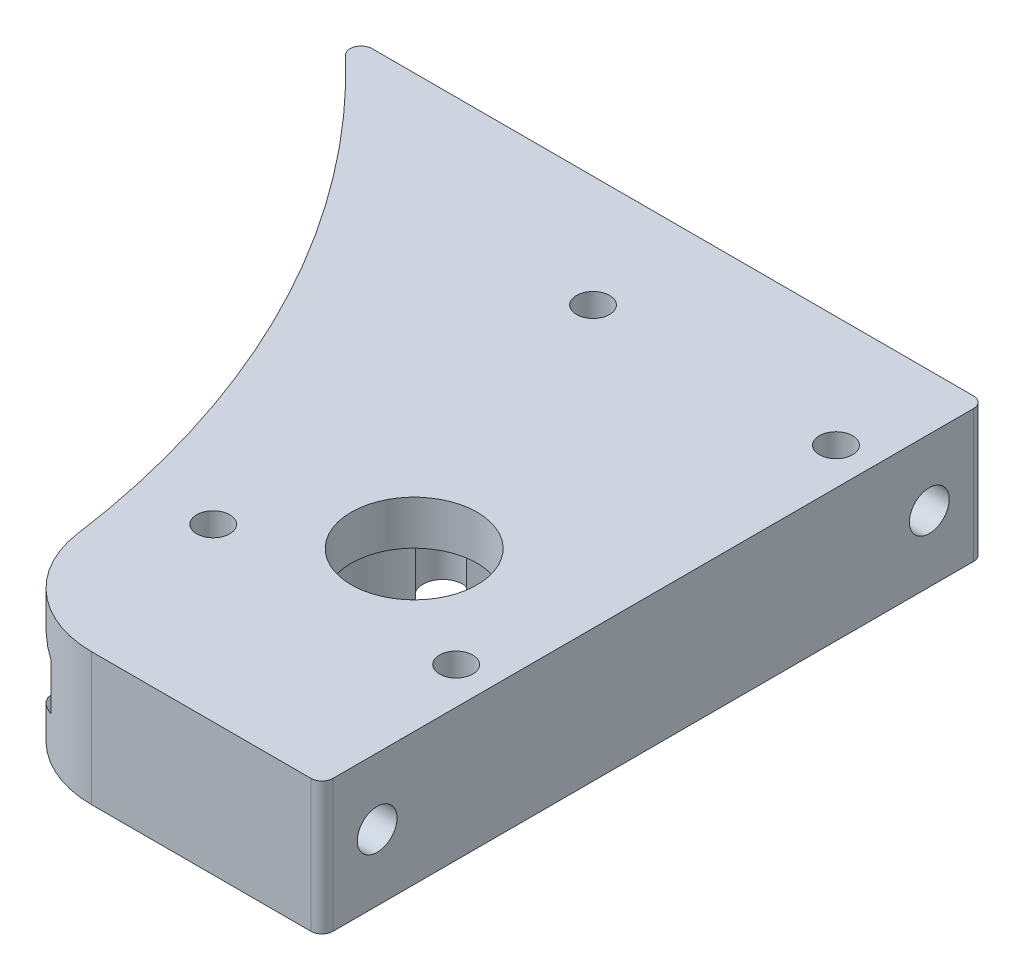
from build123d import *

# Parameters (mm, degrees)
BOSS_EXTRUDE1_DEPTH   = 15.24
CAVITY1_OUTLINE_R     = 4.445
CAVITY1_OUTLINE_R_2   = 1.143
CAVITY1_DEPTH         = 10.16
CAVITY1_START         = 10.16
CAVITY1_2_OUTLINE_R   = 1.143
CAVITY1_2_OUTLINE_R_2 = 7.239
CAVITY1_2_DEPTH       = 5.08
CAVITY1_3_OUTLINE_R   = 4.445
CAVITY1_3_DEPTH       = 3.048
CAVITY1_4_DEPTH       = 1.778
CAVITY1_START_2       = 12.192
CAVITY1_5_OUTLINE_R   = 1.905
CAVITY1_5_OUTLINE_R_2 = 1.143
CAVITY1_5_DEPTH       = 3.048
CAVITY1_6_OUTLINE_R   = 2.286
CAVITY1_6_DEPTH       = 1.27
CAVITY1_START_3       = 13.208
CAVITY1_7_DEPTH       = 0.254
FILLET1_R             = 12.7
SKETCH2_R             = 2.286
CUT_EXTRUDE1_DEPTH    = 108.072373654
CUT_EXTRUDE2_DEPTH    = 50.8
CUT_EXTRUDE4_DEPTH    = 25.4
FILLET2_R             = 1.27


# Read off the part's stored shape, not the designer's step: Cavity1
with BuildPart() as part:
    # Sketch1 → Boss-Extrude1 (new body)
    with BuildSketch(Plane(origin=(0, 0, 0), x_dir=(1, 0, 0), z_dir=(0, 1, 0))):
        with BuildLine():
            Line((0, 0), (0, 76.2))
            Line((0, 76.2), (-73.66, 76.2))
            ThreePointArc((-73.66, 76.2), (-48.155396991, 41.704814738), (-38.1, 0))
            Line((-38.1, 0), (0, 0))
        make_face()
    extrude(amount=BOSS_EXTRUDE1_DEPTH)

    # Cavity1 outline → Cavity1 (cut)
    with BuildSketch(Plane(origin=(0, 0, 0), x_dir=(1, 0, 0), z_dir=(0, 1, 0))):
        with BuildLine():
            ThreePointArc((-11.560994253, 41.539188518), (-18.2245, 43.18), (-24.888005747, 41.539188518))
            ThreePointArc((-24.888005747, 41.539188518), (-28.461347552, 42.868105214), (-28.288628852, 39.059567504))
            ThreePointArc((-28.288628852, 39.059567504), (-32.5755, 28.829), (-28.288628852, 18.598432496))
            ThreePointArc((-28.288628852, 18.598432496), (-28.461347552, 14.789894786), (-24.888005747, 16.118811482))
            ThreePointArc((-24.888005747, 16.118811482), (-18.2245, 14.478), (-11.560994253, 16.118811482))
            ThreePointArc((-11.560994253, 16.118811482), (-7.987652448, 14.789894786), (-8.160371148, 18.598432496))
            ThreePointArc((-8.160371148, 18.598432496), (-3.8735, 28.829), (-8.160371148, 39.059567504))
            ThreePointArc((-8.160371148, 39.059567504), (-7.987652448, 42.868105214), (-11.560994253, 41.539188518))
        make_face()
        with Locations((-18.2245, 54.229)):
            Circle(CAVITY1_OUTLINE_R)
        with Locations((-4.2545, 63.373)):
            Circle(CAVITY1_OUTLINE_R_2)
        with Locations((-32.1945, 63.373)):
            Circle(CAVITY1_OUTLINE_R_2)
        with Locations((-4.2545, 19.685)):
            Circle(CAVITY1_OUTLINE_R_2)
        with Locations((-32.1945, 19.685)):
            Circle(CAVITY1_OUTLINE_R_2)
    extrude(amount=CAVITY1_DEPTH, mode=Mode.SUBTRACT)

    # Cavity1 2 outline → Cavity1 2 (cut)
    with BuildSketch(Plane(origin=(0, 0, 0), x_dir=(1, 0, 0), z_dir=(0, 1, 0)).offset(CAVITY1_START)):
        with Locations((-4.2545, 63.373)):
            Circle(CAVITY1_2_OUTLINE_R)
        with Locations((-32.1945, 63.373)):
            Circle(CAVITY1_2_OUTLINE_R)
        with Locations((-4.2545, 19.685)):
            Circle(CAVITY1_2_OUTLINE_R)
        with Locations((-32.1945, 19.685)):
            Circle(CAVITY1_2_OUTLINE_R)
        with Locations((-18.2245, 28.829)):
            Circle(CAVITY1_2_OUTLINE_R_2)
    extrude(amount=CAVITY1_2_DEPTH, mode=Mode.SUBTRACT)

    # Cavity1 3 outline → Cavity1 3 (cut)
    with BuildSketch(Plane(origin=(0, 0, 0), x_dir=(1, 0, 0), z_dir=(0, 1, 0)).offset(CAVITY1_START)):
        with BuildLine():
            ThreePointArc((-21.84493784, 42.715815), (-18.2245, 37.719), (-14.60406216, 42.715815))
            ThreePointArc((-14.60406216, 42.715815), (-18.2245, 43.18), (-21.84493784, 42.715815))
        make_face()
        with Locations((-18.2245, 54.229)):
            Circle(CAVITY1_3_OUTLINE_R)
    extrude(amount=CAVITY1_3_DEPTH, mode=Mode.SUBTRACT)

    # Cavity1 4 outline → Cavity1 4 (cut)
    with BuildSketch(Plane(origin=(0, 0, 0), x_dir=(1, 0, 0), z_dir=(0, 1, 0))):
        with BuildLine():
            Line((-16.979413564, 49.961941907), (-16.962599029, 49.910648336))
            ThreePointArc((-16.962599029, 49.910648336), (-13.643456381, 51.73666679), (-11.954738237, 55.127725966))
            Line((-11.954738237, 55.127725966), (-13.895987251, 53.218058667))
            ThreePointArc((-13.895987251, 53.218058667), (-14.996989185, 51.172662495), (-16.979413564, 49.961941907))
        make_face()
        with BuildLine():
            ThreePointArc((-17.321192174, 49.848577582), (-17.141450842, 49.87704351), (-16.962599029, 49.910648336))
            Line((-16.962599029, 49.910648336), (-16.979413564, 49.961941907))
            ThreePointArc((-16.979413564, 49.961941907), (-17.131364048, 49.920510846), (-17.284686925, 49.884488936))
            Line((-17.284686925, 49.884488936), (-17.321192174, 49.848577582))
        make_face()
        with BuildLine():
            Line((-19.469586436, 49.961941907), (-19.486400971, 49.910648336))
            ThreePointArc((-19.486400971, 49.910648336), (-19.307549158, 49.87704351), (-19.127807826, 49.848577582))
            Line((-19.127807826, 49.848577582), (-19.164313075, 49.884488936))
            ThreePointArc((-19.164313075, 49.884488936), (-19.317635952, 49.920510846), (-19.469586436, 49.961941907))
        make_face()
        with BuildLine():
            ThreePointArc((-24.494261763, 55.127725966), (-22.805543619, 51.73666679), (-19.486400971, 49.910648336))
            Line((-19.486400971, 49.910648336), (-19.469586436, 49.961941907))
            ThreePointArc((-19.469586436, 49.961941907), (-21.452010815, 51.172662495), (-22.553012749, 53.218058667))
            Line((-22.553012749, 53.218058667), (-24.494261763, 55.127725966))
        make_face()
        with BuildLine():
            ThreePointArc((-18.2245, 49.784), (-17.771693393, 49.800164971), (-17.321192174, 49.848577582))
            Line((-17.321192174, 49.848577582), (-17.284686925, 49.884488936))
            ThreePointArc((-17.284686925, 49.884488936), (-17.751914917, 49.809193631), (-18.2245, 49.784))
        make_face()
        with BuildLine():
            Line((-13.895987251, 53.218058667), (-11.954738237, 55.127725966))
            ThreePointArc((-11.954738237, 55.127725966), (-11.894591344, 55.629266009), (-11.8745, 56.134))
            ThreePointArc((-11.8745, 56.134), (-12.87382539, 59.553470897), (-15.557265738, 61.896669641))
            Line((-15.557265738, 61.896669641), (-16.701846661, 58.405068942))
            ThreePointArc((-16.701846661, 58.405068942), (-14.582644766, 56.7775124), (-13.7795, 54.229))
            ThreePointArc((-13.7795, 54.229), (-13.80871784, 53.720184793), (-13.895987251, 53.218058667))
        make_face()
        with BuildLine():
            Line((-19.164313075, 49.884488936), (-19.127807826, 49.848577582))
            ThreePointArc((-19.127807826, 49.848577582), (-18.677306607, 49.800164971), (-18.2245, 49.784))
            ThreePointArc((-18.2245, 49.784), (-18.697085083, 49.809193631), (-19.164313075, 49.884488936))
        make_face()
        with BuildLine():
            ThreePointArc((-20.891734262, 61.896669641), (-23.830044051, 59.117349777), (-24.494261763, 55.127725966))
            Line((-24.494261763, 55.127725966), (-22.553012749, 53.218058667))
            ThreePointArc((-22.553012749, 53.218058667), (-22.134142573, 56.3438806), (-19.747153339, 58.405068942))
            Line((-19.747153339, 58.405068942), (-20.891734262, 61.896669641))
        make_face()
        with BuildLine():
            ThreePointArc((-15.557265738, 61.896669641), (-18.2245, 62.484), (-20.891734262, 61.896669641))
            Line((-20.891734262, 61.896669641), (-19.747153339, 58.405068942))
            ThreePointArc((-19.747153339, 58.405068942), (-18.2245, 58.674), (-16.701846661, 58.405068942))
            Line((-16.701846661, 58.405068942), (-15.557265738, 61.896669641))
        make_face()
    extrude(amount=CAVITY1_4_DEPTH, mode=Mode.SUBTRACT)

    # Cavity1 5 outline → Cavity1 5 (cut)
    # profile 1 of 4: a face of its own
    with BuildSketch(Plane(origin=(0, 0, 0), x_dir=(1, 0, 0), z_dir=(0, 1, 0)).offset(CAVITY1_START_2)):
        with Locations((-4.2545, 63.373)):
            Circle(CAVITY1_5_OUTLINE_R)
        with Locations((-4.2545, 63.373)):
            Circle(CAVITY1_5_OUTLINE_R_2, mode=Mode.SUBTRACT)
    # profile 2 of 4: a face of its own
    with BuildSketch(Plane(origin=(0, 0, 0), x_dir=(1, 0, 0), z_dir=(0, 1, 0)).offset(CAVITY1_START_2)):
        with Locations((-32.1945, 63.373)):
            Circle(CAVITY1_5_OUTLINE_R)
        with Locations((-32.1945, 63.373)):
            Circle(CAVITY1_5_OUTLINE_R_2, mode=Mode.SUBTRACT)
    # profile 3 of 4: a face of its own
    with BuildSketch(Plane(origin=(0, 0, 0), x_dir=(1, 0, 0), z_dir=(0, 1, 0)).offset(CAVITY1_START_2)):
        with Locations((-4.2545, 19.685)):
            Circle(CAVITY1_5_OUTLINE_R)
        with Locations((-4.2545, 19.685)):
            Circle(CAVITY1_5_OUTLINE_R_2, mode=Mode.SUBTRACT)
    # profile 4 of 4: a face of its own
    with BuildSketch(Plane(origin=(0, 0, 0), x_dir=(1, 0, 0), z_dir=(0, 1, 0)).offset(CAVITY1_START_2)):
        with Locations((-32.1945, 19.685)):
            Circle(CAVITY1_5_OUTLINE_R)
        with Locations((-32.1945, 19.685)):
            Circle(CAVITY1_5_OUTLINE_R_2, mode=Mode.SUBTRACT)
    extrude(amount=CAVITY1_5_DEPTH, mode=Mode.SUBTRACT)

    # Cavity1 6 outline → Cavity1 6 (cut)
    with BuildSketch(Plane(origin=(0, 0, 0), x_dir=(1, 0, 0), z_dir=(0, 1, 0)).offset(CAVITY1_START)):
        with Locations((-9.3345, 41.021)):
            Circle(CAVITY1_6_OUTLINE_R)
        with Locations((-27.1145, 41.021)):
            Circle(CAVITY1_6_OUTLINE_R)
        with Locations((-9.3345, 16.637)):
            Circle(CAVITY1_6_OUTLINE_R)
        with Locations((-27.1145, 16.637)):
            Circle(CAVITY1_6_OUTLINE_R)
    extrude(amount=CAVITY1_6_DEPTH, mode=Mode.SUBTRACT)

    # Cavity1 7 outline → Cavity1 7 (cut)
    with BuildSketch(Plane(origin=(0, 0, 0), x_dir=(1, 0, 0), z_dir=(0, 1, 0)).offset(CAVITY1_START_3)):
        with BuildLine():
            ThreePointArc((-21.84493784, 42.715815), (-18.2245, 37.719), (-14.60406216, 42.715815))
            ThreePointArc((-14.60406216, 42.715815), (-18.2245, 43.18), (-21.84493784, 42.715815))
        make_face()
    extrude(amount=CAVITY1_7_DEPTH, mode=Mode.SUBTRACT)

    # Fillet1
    fillet1_edges = [part.edges().sort_by_distance(p)[0] for p in [
        (-38.1, 7.62, 0),
    ]]
    fillet(fillet1_edges, radius=FILLET1_R)

    # Sketch2 → Cut-Extrude1 (cut, through all)
    with BuildSketch(Plane(origin=(0, 0, 0), x_dir=(0, 0, -1), z_dir=(1, 0, 0))):
        with Locations((6.35, 7.62)):
            Circle(SKETCH2_R)
        with Locations((69.85, 7.62)):
            Circle(SKETCH2_R)
    extrude(amount=-CUT_EXTRUDE1_DEPTH, mode=Mode.SUBTRACT)

    # Sketch4 → Cut-Extrude2 (cut)
    with BuildSketch(Plane(origin=(-76.2, 0, 0), x_dir=(0, 0, -1), z_dir=(1, 0, 0))):
        Polygon((6.35, 2.286), (10.969379504, 4.953), (10.969379504, 10.287), (6.35, 12.954), (1.730620496, 10.287), (1.730620496, 4.953), align=None)
    extrude(amount=CUT_EXTRUDE2_DEPTH, mode=Mode.SUBTRACT)

    # Sketch4<4> → Cut-Extrude4 (cut)
    with BuildSketch(Plane(origin=(-76.2, 0, 0), x_dir=(0, 0, -1), z_dir=(1, 0, 0))):
        Polygon((69.85, 2.286), (74.469379504, 4.953), (74.469379504, 10.287), (69.85, 12.954), (65.230620496, 10.287), (65.230620496, 4.953), align=None)
    extrude(amount=CUT_EXTRUDE4_DEPTH, mode=Mode.SUBTRACT)

    # Fillet2
    # the kernel refuses this fillet: 1.27 mm, written as the material it takes off along each edge
    with BuildSketch(Plane(origin=(-73.66, -8.077592452, -76.2), x_dir=(0.7323839064135403, 0, 0.6808919250706698), z_dir=(0, 1, 0))) as fillet2_piece_1:
        with BuildLine():
            CenterArc((3.231092231, 1.269859429), FILLET2_R, 132.913380591, 136.234131595)
            Line((2.366359486, 2.19998699), (0, 0))
            ThreePointArc((0, 0), (1.606098477, 0.011948565), (3.212196954, 0))
        make_face()
    extrude(amount=31.395184904, mode=Mode.SUBTRACT)
    with BuildSketch(Plane(origin=(0, -3.175, 0), x_dir=(-1, 0, 0), z_dir=(0, 1, 0))) as fillet2_piece_2:
        with BuildLine():
            CenterArc((FILLET2_R, -FILLET2_R), FILLET2_R, 90, 90)
            Line((0, -FILLET2_R), (0, 0))
            Line((0, 0), (FILLET2_R, 0))
        make_face()
    extrude(amount=21.59, mode=Mode.SUBTRACT)
    with BuildSketch(Plane(origin=(0, -3.175, -76.2), x_dir=(-1, 0, 0), z_dir=(0, 1, 0))) as fillet2_piece_3:
        with BuildLine():
            CenterArc((FILLET2_R, FILLET2_R), FILLET2_R, 180, 90)
            Line((0, FILLET2_R), (0, 0))
            Line((0, 0), (FILLET2_R, 0))
        make_face()
    extrude(amount=21.59, mode=Mode.SUBTRACT)


solid = part.part
